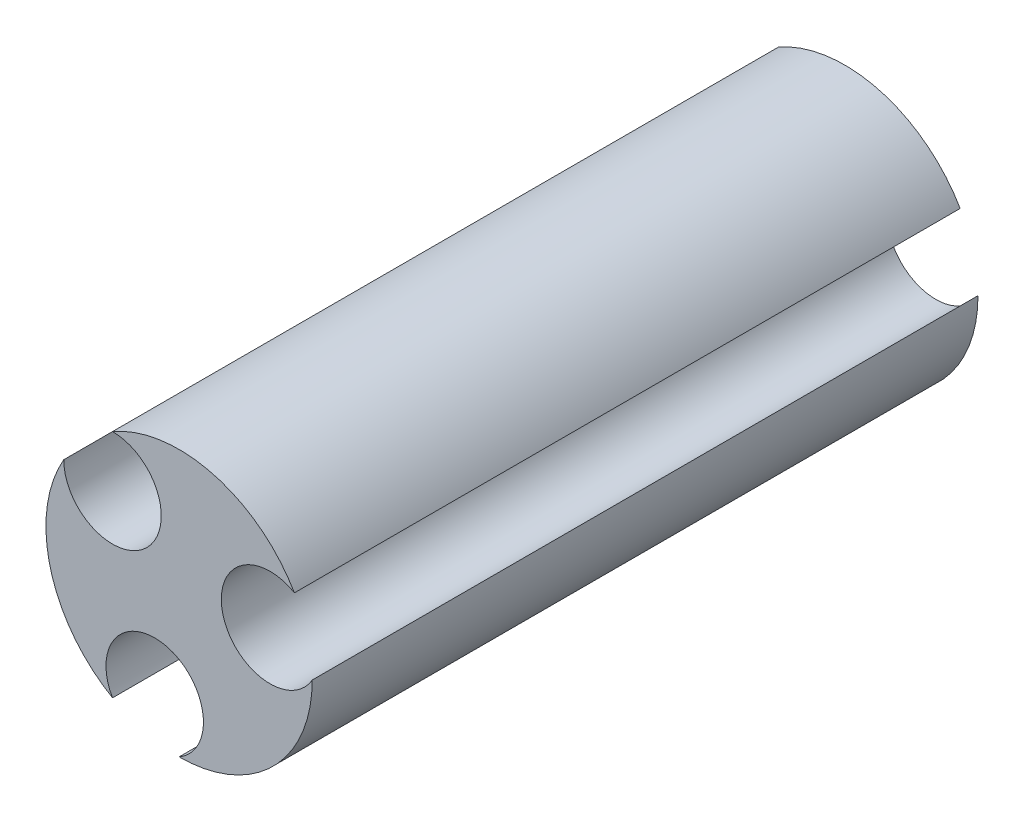
from build123d import *

# Parameters (mm, degrees)
BOSS_EXTRUDE1_DEPTH = 10


with BuildPart() as part:
    # Sketch2 → Boss-Extrude1 (new body)
    with BuildSketch(Plane.XY):
        with BuildLine():
            ThreePointArc((-1.732050808, 1), (-1.931851653, -0.51763809), (-1, -1.732050808))
            ThreePointArc((-1, -1.732050808), (-0.176556713, -0.658918623), (0, -2))
            ThreePointArc((0, -2), (1.414213562, -1.414213562), (2, 0))
            ThreePointArc((2, 0), (0.658918623, 0.176556713), (1.732050808, 1))
            ThreePointArc((1.732050808, 1), (0.51763809, 1.931851653), (-1, 1.732050808))
            ThreePointArc((-1, 1.732050808), (-0.48236191, 0.48236191), (-1.732050808, 1))
        make_face()
    extrude(amount=BOSS_EXTRUDE1_DEPTH)


solid = part.part
